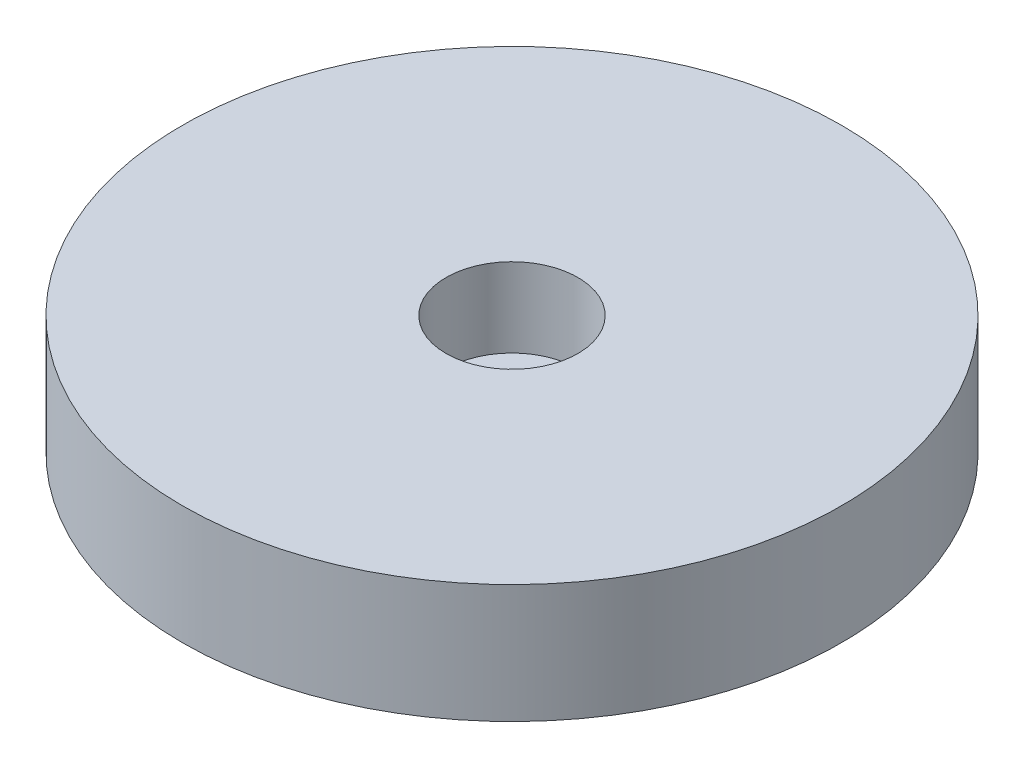
from build123d import *

# Parameters (mm, degrees)
CROQUIS1_R              = 25
CROQUIS1_R_2            = 3.1
SALIENTE_EXTRUIR1_DEPTH = 9
CROQUIS3_R              = 5
CORTAR_EXTRUIR1_DEPTH   = 6


with BuildPart() as part:
    # Croquis1 → Saliente-Extruir1 (new body)
    with BuildSketch(Plane(origin=(0, 0, 0), x_dir=(1, 0, 0), z_dir=(0, 1, 0))):
        Circle(CROQUIS1_R)
        Circle(CROQUIS1_R_2, mode=Mode.SUBTRACT)
    extrude(amount=SALIENTE_EXTRUIR1_DEPTH)

    # Croquis3 → Cortar-Extruir1 (cut)
    with BuildSketch(Plane(origin=(0, 9, 0), x_dir=(1, 0, 0), z_dir=(0, 1, 0))):
        Circle(CROQUIS3_R)
    extrude(amount=-CORTAR_EXTRUIR1_DEPTH, mode=Mode.SUBTRACT)


solid = part.part
